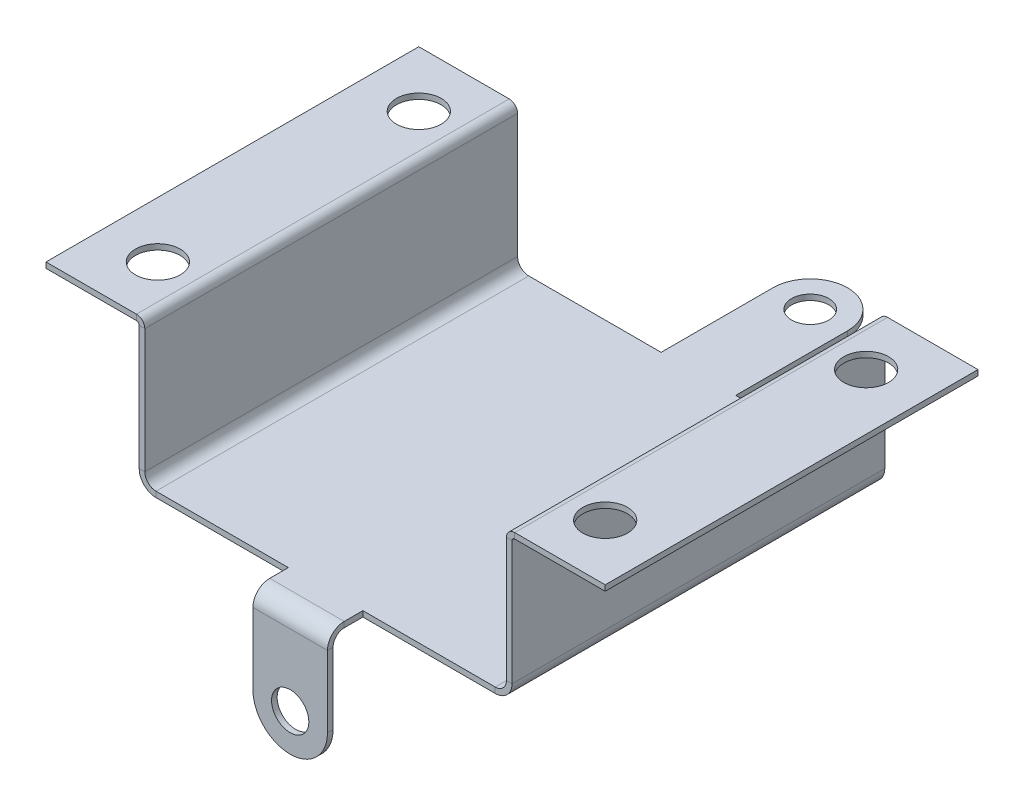
from build123d import *

# Parameters (mm, degrees)
SCHIZZO1_R                           = 5
BASE_FLANGIA1_DEPTH                  = 1.5
BORDO_FLANGIA1_STRIP_W               = 12
BORDO_FLANGIA1_STRIP_H               = 1.5
BORDO_FLANGIA1_STRIP_CUT_DEPTH       = 100
BORDO_FLANGIA1_STRIP_2_W             = 12
BORDO_FLANGIA1_STRIP_2_H             = 1.5
BORDO_FLANGIA1_STRIP_CUT_2_DEPTH     = 100
BORDO_FLANGIA1_DEPTH                 = 100
BORDO_FLANGIA1_BEND_DEPTH            = 100
BORDO_FLANGIA2_STRIP_W               = 7.4732
BORDO_FLANGIA2_STRIP_H               = 1.5
BORDO_FLANGIA2_STRIP_CUT_DEPTH       = 100
BORDO_FLANGIA2_STRIP_2_W             = 7.4732
BORDO_FLANGIA2_STRIP_2_H             = 1.5
BORDO_FLANGIA2_STRIP_CUT_2_DEPTH     = 100
BORDO_FLANGIA2_DEPTH                 = 100
BORDO_FLANGIA2_BEND_DEPTH            = 100
PIEGATURA_START                      = 58.9178
PIEGATURA_DELLO_SCHIZZO1_OUTLINE_W   = 20
PIEGATURA_DELLO_SCHIZZO1_OUTLINE_H   = 1.5
PIEGATURA_DELLO_SCHIZZO1_DEPTH       = 32.0822
PIEGATURA_START_2                    = 56.266894772
PIEGATURA_DELLO_SCHIZZO1_2_OUTLINE_R = 5
PIEGATURA_DELLO_SCHIZZO1_2_DEPTH     = 3.233105228
PIEGATURA_START_3                    = -10
PIEGATURA_DELLO_SCHIZZO1_3_DEPTH     = 20
PIEGATURA_DELLO_SCHIZZO1_4_DEPTH     = 20
SCHIZZO19_R                          = 6
TAGLIO_ESTRUSIONE1_DEPTH             = 138.567372501


with BuildPart() as part:
    # Base-Flangia1: sheet metal written as solids
    # Schizzo1 → Base-Flangia1 (new body)
    with BuildSketch(Plane(origin=(0, 0, 0), x_dir=(1, 0, 0), z_dir=(0, 1, 0))):
        with BuildLine():
            Line((10, 50), (10, 80))
            ThreePointArc((10, 80), (0, 90), (-10, 80))
            Line((-10, 80), (-10, 50))
            Line((-10, 50), (-50, 50))
            Line((-50, 50), (-50, -50))
            Line((-50, -50), (-10, -50))
            Line((-10, -50), (-10, -80))
            ThreePointArc((-10, -80), (0, -90), (10, -80))
            Line((10, -80), (10, -50))
            Line((10, -50), (50, -50))
            Line((50, -50), (50, 50))
            Line((50, 50), (10, 50))
        make_face()
        with Locations(Location((0, 80, 0), (0, 0, 270))):
            Circle(SCHIZZO1_R, mode=Mode.SUBTRACT)
        with Locations(Location((0, -80, 0), (0, 0, 270))):
            Circle(SCHIZZO1_R, mode=Mode.SUBTRACT)
    extrude(amount=-BASE_FLANGIA1_DEPTH)

    # Bordo-Flangia1: sheet metal written as solids
    # Bordo-Flangia1 strip (on a plane across the edge) → Bordo-Flangia1 strip cut (cut)
    with BuildSketch(Plane(origin=(-50, 0, -50), x_dir=(1, 0, 0), z_dir=(0, 0, 1))):
        with Locations((-1.5, -0.75)):
            Rectangle(BORDO_FLANGIA1_STRIP_W, BORDO_FLANGIA1_STRIP_H)
    extrude(amount=BORDO_FLANGIA1_STRIP_CUT_DEPTH, mode=Mode.SUBTRACT)

    # Bordo-Flangia1 strip 2 (on a plane across the edge) → Bordo-Flangia1 strip cut 2 (cut)
    with BuildSketch(Plane(origin=(50, 0, 50), x_dir=(-1, 0, 0), z_dir=(0, 0, -1))):
        with Locations((-1.5, -0.75)):
            Rectangle(BORDO_FLANGIA1_STRIP_2_W, BORDO_FLANGIA1_STRIP_2_H)
    extrude(amount=BORDO_FLANGIA1_STRIP_CUT_2_DEPTH, mode=Mode.SUBTRACT)

    # Bordo-Flangia1 section (on a plane across the edge) → Bordo-Flangia1 (add)
    with BuildSketch(Plane(origin=(-50, 0, -50), x_dir=(1, 0, 0), z_dir=(0, 0, 1))):
        with BuildLine():
            Line((0, 3), (0, 38.5))
            Line((0, 38.5), (1.5, 38.5))
            Line((1.5, 38.5), (1.5, 3))
            ThreePointArc((1.5, 3), (2.378679656, 0.878679656), (4.5, 0))
            Line((4.5, 0), (4.5, -1.5))
            ThreePointArc((4.5, -1.5), (1.318019485, -0.181980515), (0, 3))
        make_face()
    extrude(amount=BORDO_FLANGIA1_DEPTH)

    # Bordo-Flangia1 section 2 (on a plane across the edge) → Bordo-Flangia1 bend (add)
    with BuildSketch(Plane(origin=(50, 0, 50), x_dir=(-1, 0, 0), z_dir=(0, 0, -1))):
        with BuildLine():
            Line((0, 3), (0, 38.5))
            Line((0, 38.5), (1.5, 38.5))
            Line((1.5, 38.5), (1.5, 3))
            ThreePointArc((1.5, 3), (2.378679656, 0.878679656), (4.5, 0))
            Line((4.5, 0), (4.5, -1.5))
            ThreePointArc((4.5, -1.5), (1.318019485, -0.181980515), (0, 3))
        make_face()
    extrude(amount=BORDO_FLANGIA1_BEND_DEPTH)

    # Bordo-Flangia2: sheet metal written as solids
    # Bordo-Flangia2 strip (on a plane across the edge) → Bordo-Flangia2 strip cut (cut)
    with BuildSketch(Plane(origin=(50, 38.5, -50), x_dir=(0, -1, 0), z_dir=(0, 0, 1))):
        with Locations((-1.5, -0.75)):
            Rectangle(BORDO_FLANGIA2_STRIP_W, BORDO_FLANGIA2_STRIP_H)
    extrude(amount=BORDO_FLANGIA2_STRIP_CUT_DEPTH, mode=Mode.SUBTRACT)

    # Bordo-Flangia2 strip 2 (on a plane across the edge) → Bordo-Flangia2 strip cut 2 (cut)
    with BuildSketch(Plane(origin=(-50, 38.5, 50), x_dir=(0, -1, 0), z_dir=(0, 0, -1))):
        with Locations((-1.5, -0.75)):
            Rectangle(BORDO_FLANGIA2_STRIP_2_W, BORDO_FLANGIA2_STRIP_2_H)
    extrude(amount=BORDO_FLANGIA2_STRIP_CUT_2_DEPTH, mode=Mode.SUBTRACT)

    # Bordo-Flangia2 section (on a plane across the edge) → Bordo-Flangia2 (add)
    with BuildSketch(Plane(origin=(50, 38.5, -50), x_dir=(0, -1, 0), z_dir=(0, 0, 1))):
        with BuildLine():
            Line((0, 0.7366), (0, 25))
            Line((0, 25), (1.5, 25))
            Line((1.5, 25), (1.5, 0.7366))
            ThreePointArc((1.5, 0.7366), (1.715745145, 0.215745145), (2.2366, 0))
            Line((2.2366, 0), (2.2366, -1.5))
            ThreePointArc((2.2366, -1.5), (0.655084973, -0.844915027), (0, 0.7366))
        make_face()
    extrude(amount=BORDO_FLANGIA2_DEPTH)

    # Bordo-Flangia2 section 2 (on a plane across the edge) → Bordo-Flangia2 bend (add)
    with BuildSketch(Plane(origin=(-50, 38.5, 50), x_dir=(0, -1, 0), z_dir=(0, 0, -1))):
        with BuildLine():
            Line((0, 0.7366), (0, 25))
            Line((0, 25), (1.5, 25))
            Line((1.5, 25), (1.5, 0.7366))
            ThreePointArc((1.5, 0.7366), (1.715745145, 0.215745145), (2.2366, 0))
            Line((2.2366, 0), (2.2366, -1.5))
            ThreePointArc((2.2366, -1.5), (0.655084973, -0.844915027), (0, 0.7366))
        make_face()
    extrude(amount=BORDO_FLANGIA2_BEND_DEPTH)

    # Piegatura dello schizzo1: read off the stored shape, not the designer's step
    # Piegatura dello schizzo1 outline → Piegatura dello schizzo1 (cut)
    with BuildSketch(Plane.XY.offset(PIEGATURA_START)):
        with Locations((0, -0.75)):
            Rectangle(PIEGATURA_DELLO_SCHIZZO1_OUTLINE_W, PIEGATURA_DELLO_SCHIZZO1_OUTLINE_H)
    extrude(amount=PIEGATURA_DELLO_SCHIZZO1_DEPTH, mode=Mode.SUBTRACT)

    # Piegatura dello schizzo1 2 outline → Piegatura dello schizzo1 2 (add)
    with BuildSketch(Plane.XY.offset(PIEGATURA_START_2)):
        with BuildLine():
            Line((10, -23.609513775), (10, -1.5))
            Line((10, -1.5), (-10, -1.5))
            Line((-10, -1.5), (-10, -23.609513775))
            ThreePointArc((-10, -23.609513775), (0, -33.609513775), (10, -23.609513775))
        make_face()
        with Locations((0, -23.609513775)):
            Circle(PIEGATURA_DELLO_SCHIZZO1_2_OUTLINE_R, mode=Mode.SUBTRACT)
    extrude(amount=PIEGATURA_DELLO_SCHIZZO1_2_DEPTH)

    # Piegatura dello schizzo1 3 outline → Piegatura dello schizzo1 3 (cut)
    with BuildSketch(Plane.YZ.offset(PIEGATURA_START_3)):
        with BuildLine():
            ThreePointArc((-1.780629183, 56.266894772), (-2.887654552, 57.529889753), (-4.5, 58))
            Line((-4.5, 58), (-35, 58))
            Line((-35, 58), (-35, 56.266894772))
            Line((-35, 56.266894772), (-1.780629183, 56.266894772))
        make_face()
        with BuildLine():
            Line((1, 54), (1, 58.9178))
            Line((1, 58.9178), (-1.5, 58.9178))
            Line((-1.5, 58.9178), (-1.5, 61))
            Line((-1.5, 61), (-35, 61))
            Line((-35, 61), (-35, 59.500000008))
            Line((-35, 59.500000008), (-4.5, 59.5))
            ThreePointArc((-4.5, 59.5), (-1.318019485, 58.181980515), (0, 55))
            Line((0, 55), (0, 54))
            Line((0, 54), (1, 54))
        make_face()
    extrude(amount=PIEGATURA_DELLO_SCHIZZO1_3_DEPTH, mode=Mode.SUBTRACT)

    # Piegatura dello schizzo1 4 outline → Piegatura dello schizzo1 4 (add)
    with BuildSketch(Plane.YZ.offset(PIEGATURA_START_3)):
        with BuildLine():
            Line((-0.182016948, 56.266894772), (-1.780629183, 56.266894772))
            ThreePointArc((-1.780629183, 56.266894772), (-1.570997401, 55.6488018), (-1.5, 55))
            Line((-1.5, 55), (-1.500000001, 54))
            Line((-1.500000001, 54), (0, 54))
            Line((0, 54), (0, 55))
            ThreePointArc((0, 55), (-0.045736664, 55.639951665), (-0.182016948, 56.266894772))
        make_face()
    extrude(amount=PIEGATURA_DELLO_SCHIZZO1_4_DEPTH)

    # Schizzo19 → Taglio-Estrusione1 (cut, through all)
    with BuildSketch(Plane(origin=(0, 38.5, 0), x_dir=(1, 0, 0), z_dir=(0, 1, 0))):
        with Locations(Location((-60, 35, 0), (0, 0, 270))):
            Circle(SCHIZZO19_R)
        with Locations(Location((-60, -35, 0), (0, 0, 90))):
            Circle(SCHIZZO19_R)
        with Locations(Location((60, -35, 0), (0, 0, 270))):
            Circle(SCHIZZO19_R)
        with Locations(Location((60, 35, 0), (0, 0, 90))):
            Circle(SCHIZZO19_R)
    extrude(amount=-TAGLIO_ESTRUSIONE1_DEPTH, mode=Mode.SUBTRACT)


solid = part.part
